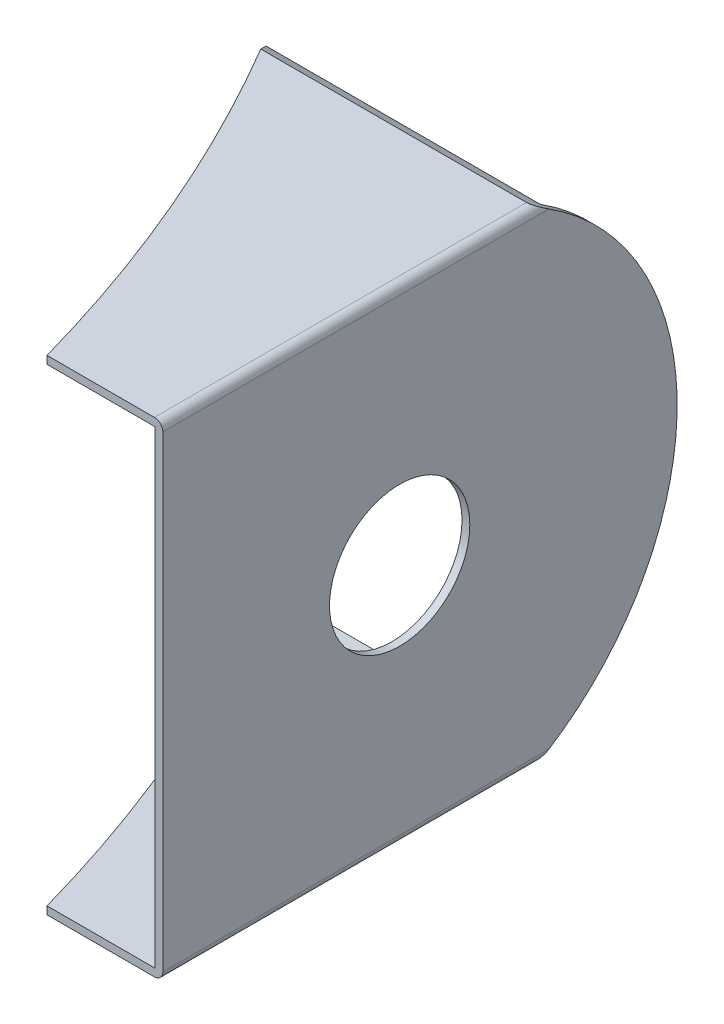
from build123d import *

# Parameters (mm, degrees)
SKETCH1_W               = 730
SKETCH1_H               = 150
BASE_FLANGE1_DEPTH      = 2.5
EDGE_FLANGE1_DEPTH      = 730
EDGE_FLANGE1_BEND_DEPTH = 730
SKETCH13_R              = 22.5
CUT_EXTRUDE2_DEPTH      = 10
CUT_EXTRUDE3_DEPTH      = 396.173746598
CUT_EXTRUDE3_DEPTH_BACK = 396.173746598
SKETCH14_W              = 631.337566112
SKETCH14_H              = 273.157514278
CUT_EXTRUDE4_DEPTH      = 396.173746598
CUT_EXTRUDE4_DEPTH_BACK = 396.173746598
CUT_EXTRUDE5_DEPTH      = 408.87885472


# Sheet-metal steps are written as plain solids
with BuildPart() as part:
    # Sketch1 → Base-Flange1 (new body)
    with BuildSketch(Plane(origin=(0, 0, 0), x_dir=(0, 0, -1), z_dir=(1, 0, 0))):
        Rectangle(SKETCH1_W, SKETCH1_H)
    extrude(amount=-BASE_FLANGE1_DEPTH)

    # Edge-Flange1 section (across the edge) → Edge-Flange1 (add)
    with BuildSketch(Plane(origin=(-2.5, 75.2, 365), x_dir=(0, -1, 0), z_dir=(0, 0, -1))):
        with BuildLine():
            Line((-2.5, 0.2), (-2.5, 127.5))
            Line((-2.5, 127.5), (0, 127.5))
            Line((0, 127.5), (0, 0.2))
            ThreePointArc((0, 0.2), (0.058578644, 0.058578644), (0.2, 0))
            Line((0.2, 0), (0.2, -2.5))
            ThreePointArc((0.2, -2.5), (-1.709188309, -1.709188309), (-2.5, 0.2))
        make_face()
    extrude(amount=EDGE_FLANGE1_DEPTH)

    # Edge-Flange1 section 2 (across the edge) → Edge-Flange1 bend (add)
    with BuildSketch(Plane(origin=(-2.5, -75.2, -365), x_dir=(0, 1, 0), z_dir=(0, 0, 1))):
        with BuildLine():
            Line((-2.5, 0.2), (-2.5, 127.5))
            Line((-2.5, 127.5), (0, 127.5))
            Line((0, 127.5), (0, 0.2))
            ThreePointArc((0, 0.2), (0.058578644, 0.058578644), (0.2, 0))
            Line((0.2, 0), (0.2, -2.5))
            ThreePointArc((0.2, -2.5), (-1.709188309, -1.709188309), (-2.5, 0.2))
        make_face()
    extrude(amount=EDGE_FLANGE1_BEND_DEPTH)

    # Sketch13 → Cut-Extrude2 (cut)
    with BuildSketch(Plane(origin=(0, 0, 0), x_dir=(0, 0, -1), z_dir=(1, 0, 0))):
        with Locations((265, 0)):
            Circle(SKETCH13_R)
        with Locations((-290, 0)):
            Circle(SKETCH13_R)
    extrude(amount=-CUT_EXTRUDE2_DEPTH, mode=Mode.SUBTRACT)

    # Sketch14 → Cut-Extrude3 (cut, two sides: drawn at the far end of the back side and taken through both)
    with BuildSketch(Plane(origin=(0, 0, 0), x_dir=(0, 0, -1), z_dir=(1, 0, 0)).offset(-CUT_EXTRUDE3_DEPTH_BACK)):
        with Locations((-126.629311255, -14.019673746)):
            Rectangle(SKETCH14_W, SKETCH14_H)
    extrude(amount=CUT_EXTRUDE3_DEPTH + CUT_EXTRUDE3_DEPTH_BACK, mode=Mode.SUBTRACT)

    # Sketch15 → Cut-Extrude4 (cut, two sides: drawn at the far end of the back side and taken through both)
    with BuildSketch(Plane(origin=(0, 0, 0), x_dir=(0, 0, -1), z_dir=(1, 0, 0)).offset(-CUT_EXTRUDE4_DEPTH_BACK)):
        with BuildLine():
            Line((302.266550641, 80.822052704), (310.532003477, 105.351783703))
            Line((310.532003477, 105.351783703), (400.668447303, 94.566226322))
            Line((400.668447303, 94.566226322), (380.252927975, -108.048173048))
            Line((380.252927975, -108.048173048), (291.286888445, -85.029403714))
            ThreePointArc((291.286888445, -85.029403714), (353.805609642, -5.879089735), (302.266550641, 80.822052704))
        make_face()
    extrude(amount=CUT_EXTRUDE4_DEPTH + CUT_EXTRUDE4_DEPTH_BACK, mode=Mode.SUBTRACT)

    # Sketch17 → Cut-Extrude5 (cut, through all)
    with BuildSketch(Plane(origin=(0, 77.7, 0), x_dir=(1, 0, 0), z_dir=(0, 1, 0))):
        with BuildLine():
            Line((-118.819244886, 354.751470834), (-213.837944087, 354.751470834))
            Line((-213.837944087, 354.751470834), (-213.837944087, 158.380448287))
            Line((-213.837944087, 158.380448287), (-29.613553222, 158.380448287))
            ThreePointArc((-29.613553222, 158.380448287), (-63.53464157, 261.418373894), (-118.819244886, 354.751470834))
        make_face()
    extrude(amount=-CUT_EXTRUDE5_DEPTH, mode=Mode.SUBTRACT)


solid = part.part
